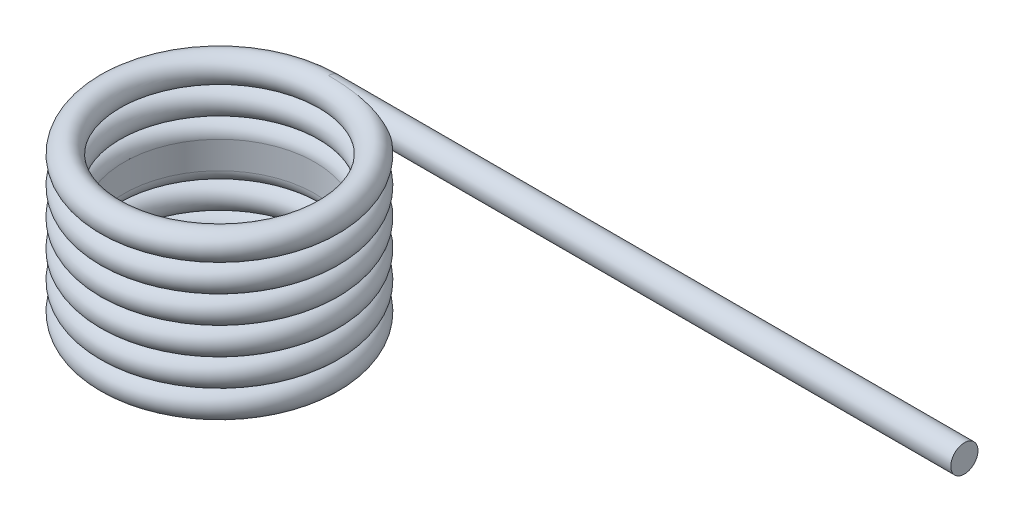
from build123d import *
from build123d.topology import SkipClean

# Parameters (mm, degrees)
SKETCH1_R               = 0.2286
BOSS_EXTRUDE1_START     = -10.6680001
BOSS_EXTRUDE1_OUTLINE_R = 0.2286
BOSS_EXTRUDE1_DEPTH     = 10.6680001


# Read off the part's stored shape, not the designer's step: Boss-Extrude1
with BuildPart() as part:
    # Sketch1 → Revolve1 (revolve)
    with SkipClean():  # the faces are left unmerged after this step: merging them gives an invalid solid
        with BuildSketch(Plane(origin=(0, 0, 0), x_dir=(0, 0, -1), z_dir=(1, 0, 0))):
            with Locations((0.2286, -0.2286)):
                Circle(SKETCH1_R)
            with Locations((0.2286, -2.5146)):
                Circle(SKETCH1_R)
            with Locations((0.2286, -0.6858)):
                Circle(SKETCH1_R)
            with Locations((0.2286, -2.0574)):
                Circle(SKETCH1_R)
            with BuildLine():
                Line((0.4572, -1.143), (0.4572, -1.6002))
                ThreePointArc((0.4572, -1.6002), (0.06695539, -1.76184461), (0.2286, -1.3716))
                ThreePointArc((0.2286, -1.3716), (0.06695539, -0.98135539), (0.4572, -1.143))
            make_face()
        revolve(axis=Axis((0, 0, -2.0574), (0, -1, 0)))

    # Boss-Extrude1 outline → Boss-Extrude1 (add)
    with BuildSketch(Plane(origin=(10.668, 0, 0), x_dir=(0, 0, -1), z_dir=(1, 0, 0)).offset(BOSS_EXTRUDE1_START)):
        with Locations((3.8862, -0.2286)):
            Circle(BOSS_EXTRUDE1_OUTLINE_R)
    extrude(amount=BOSS_EXTRUDE1_DEPTH)


solid = part.part
